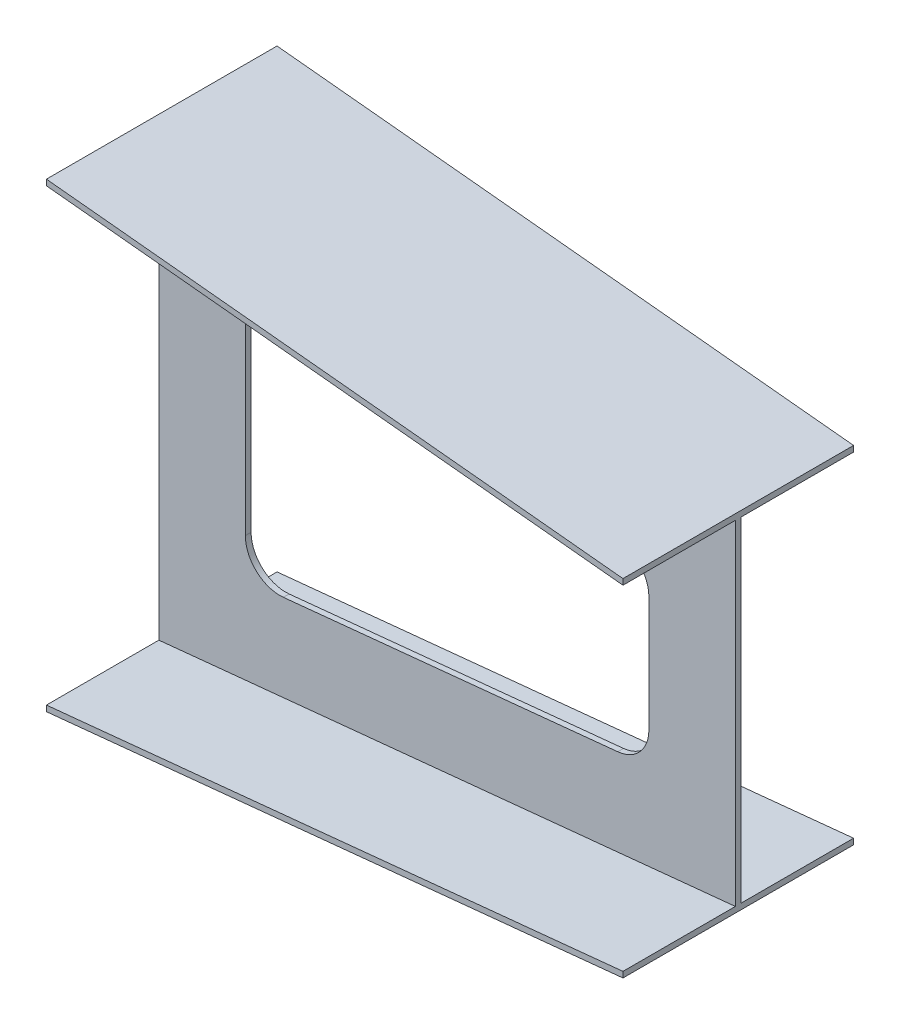
from build123d import *

# Parameters (mm, degrees)
CUT_EXTRUDE1_DEPTH = 10


with BuildPart() as part:
    # Sketch1 → Loft4 section 0
    with BuildSketch(Plane(origin=(0, 0, 0), x_dir=(0, 0, -1), z_dir=(1, 0, 0))):
        with BuildLine():
            Line((-205, 400), (195, 400))
            Line((195, 400), (195, 390))
            Line((195, 390), (0, 390))
            Line((0, 390), (0, -390))
            Line((0, -390), (195, -390))
            Line((195, -390), (195, -400))
            Line((195, -400), (-205, -400))
            Line((-205, -400), (-205, -390))
            Line((-205, -390), (-10, -390))
            Line((-10, -390), (-10, 390))
            Line((-10, 390), (-205, 390))
            Line((-205, 390), (-205, 400))
        make_face()
    # Sketch4 → Loft4 section 1
    with BuildSketch(Plane(origin=(1000, 0, -1000), x_dir=(0, 0, 1), z_dir=(-1, 0, 0))):
        with BuildLine():
            Line((805, 300), (1205, 300))
            Line((1205, 300), (1205, 290))
            Line((1205, 290), (1010, 290))
            Line((1010, 290), (1010, -290))
            Line((1010, -290), (1205, -290))
            Line((1205, -290), (1205, -300))
            Line((1205, -300), (805, -300))
            Line((805, -300), (805, -290))
            Line((805, -290), (1000, -290))
            Line((1000, -290), (1000, 290))
            Line((1000, 290), (805, 290))
            Line((805, 290), (805, 300))
        make_face()
    loft()

    # Sketch6 → Cut-Extrude1 (cut)
    with BuildSketch(Plane.XY.offset(10)):
        with BuildLine():
            Line((215.970223141, -217.654843369), (795.970223141, -159.654843369))
            ThreePointArc((795.970223141, -159.654843369), (834.487152013, -140.212931202), (850, -99.952611956))
            Line((850, -99.952611956), (850, 99.952611956))
            ThreePointArc((850, 99.952611956), (834.487152013, 140.212931202), (795.970223141, 159.654843369))
            Line((795.970223141, 159.654843369), (215.970223141, 217.654843369))
            ThreePointArc((215.970223141, 217.654843369), (169.739680754, 202.43976397), (150, 157.952611956))
            Line((150, 157.952611956), (150, -157.952611956))
            ThreePointArc((150, -157.952611956), (169.739680754, -202.43976397), (215.970223141, -217.654843369))
        make_face()
    extrude(amount=-CUT_EXTRUDE1_DEPTH, mode=Mode.SUBTRACT)


solid = part.part
